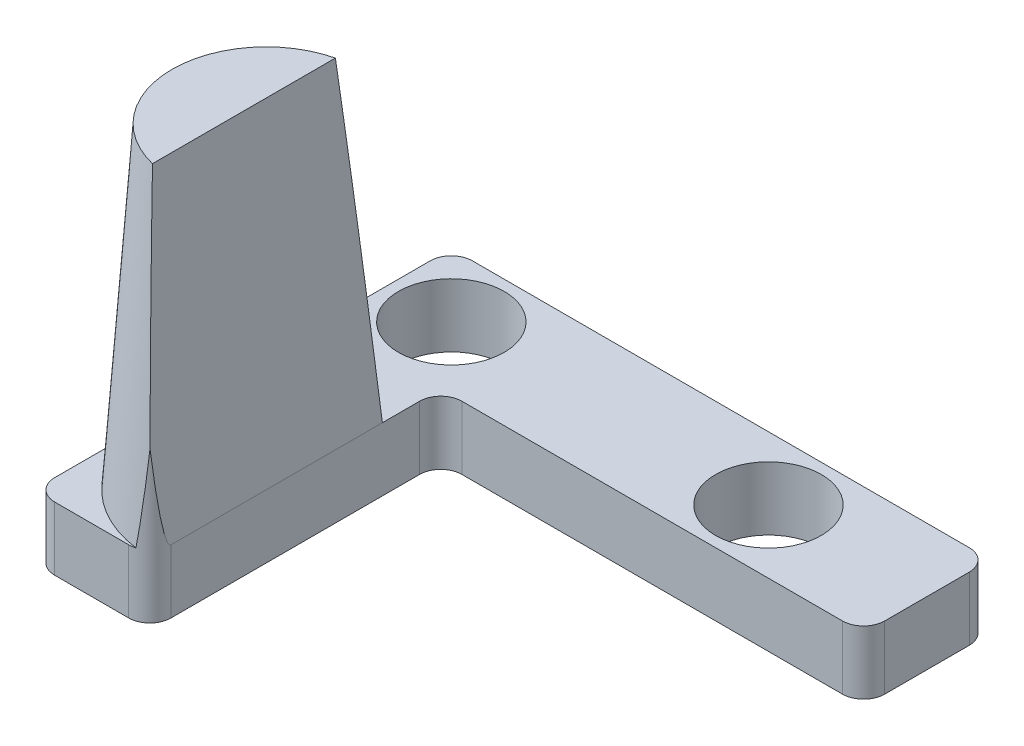
from build123d import *

# Parameters (mm, degrees)
SKETCH1_R           = 2.5
BOSS_EXTRUDE1_DEPTH = 3
BOSS_EXTRUDE2_DEPTH = 15
BOSS_EXTRUDE2_DRAFT = 4
FILLET2_R           = 1
FILLET3_R           = 1
FILLET4_R           = 1
FILLET5_R           = 1
FILLET6_R           = 1
FILLET7_R           = 1


with BuildPart() as part:
    # Sketch1 → Boss-Extrude1 (new body)
    with BuildSketch(Plane(origin=(0, 0, 0), x_dir=(1, 0, 0), z_dir=(0, 1, 0))):
        Polygon((0, 0), (-25.5, 0), (-25.5, -19.76), (-20, -19.76), (-20, -6), (0, -6), align=None)
        with Locations(Location((-7.5, -3, 0), (0, 0, 270))):
            Circle(SKETCH1_R, mode=Mode.SUBTRACT)
        with Locations(Location((-22.5, -3, 0), (0, 0, 270))):
            Circle(SKETCH1_R, mode=Mode.SUBTRACT)
    extrude(amount=BOSS_EXTRUDE1_DEPTH)


with BuildPart() as boss_extrude2_tool:
    # Sketch3 → Boss-Extrude2 (with draft: the straight prism first)
    with BuildSketch(Plane(origin=(0, 3, 0), x_dir=(1, 0, 0), z_dir=(0, 1, 0))):
        with BuildLine():
            ThreePointArc((-20, -8.76), (-25.5, -14.26), (-20, -19.76))
            Line((-20, -19.76), (-20, -8.76))
        make_face()
    extrude(amount=BOSS_EXTRUDE2_DEPTH)
    # Boss-Extrude2: the draft: its side faces are tilted about the plane it starts from
    boss_extrude2_sides = [boss_extrude2_tool.faces().sort_by_distance(p)[0] for p in [
        (-25.5, 10.5, 14.26),
        (-20, 10.5, 14.26),
    ]]
    draft(boss_extrude2_sides, Plane(origin=(0, 3, 0), x_dir=(1, 0, 0), z_dir=(0, 1, 0)), BOSS_EXTRUDE2_DRAFT)


with BuildPart() as part_1:
    add(part.part)

    # Boss-Extrude2: add boss_extrude2_tool
    add(boss_extrude2_tool.part)

    # Fillet2
    fillet2_edges = [part_1.edges().sort_by_distance(p)[0] for p in [
        (-20, 1.5, 6),
    ]]
    fillet(fillet2_edges, radius=FILLET2_R)

    # Fillet3
    # the kernel refuses this fillet: 1 mm, written as the material it takes off along each edge
    with BuildSketch(Plane(origin=(-20, -6, 19.76), x_dir=(0, 0, -1), z_dir=(0, 1, 0))) as fillet3_piece_1:
        with BuildLine():
            CenterArc((FILLET3_R, FILLET3_R), FILLET3_R, 180, 90)
            Line((0, FILLET3_R), (-FILLET3_R * 0.02, FILLET3_R))
            Line((-FILLET3_R * 0.02, FILLET3_R), (-FILLET3_R * 0.02, -FILLET3_R * 0.02))
            Line((-FILLET3_R * 0.02, -FILLET3_R * 0.02), (FILLET3_R, -FILLET3_R * 0.02))
            Line((FILLET3_R, -FILLET3_R * 0.02), (FILLET3_R, 0))
        make_face()
    extrude(amount=15, mode=Mode.SUBTRACT)

    # Fillet4
    fillet4_edges = [part_1.edges().sort_by_distance(p)[0] for p in [
        (-25.5, 1.5, 19.76),
    ]]
    fillet(fillet4_edges, radius=FILLET4_R)

    # Fillet5
    fillet5_edges = [part_1.edges().sort_by_distance(p)[0] for p in [
        (-25.5, 1.5, 0),
    ]]
    fillet(fillet5_edges, radius=FILLET5_R)

    # Fillet6
    fillet6_edges = [part_1.edges().sort_by_distance(p)[0] for p in [
        (0, 1.5, 0),
    ]]
    fillet(fillet6_edges, radius=FILLET6_R)

    # Fillet7
    fillet7_edges = [part_1.edges().sort_by_distance(p)[0] for p in [
        (0, 1.5, 6),
    ]]
    fillet(fillet7_edges, radius=FILLET7_R)


solid = part_1.part
